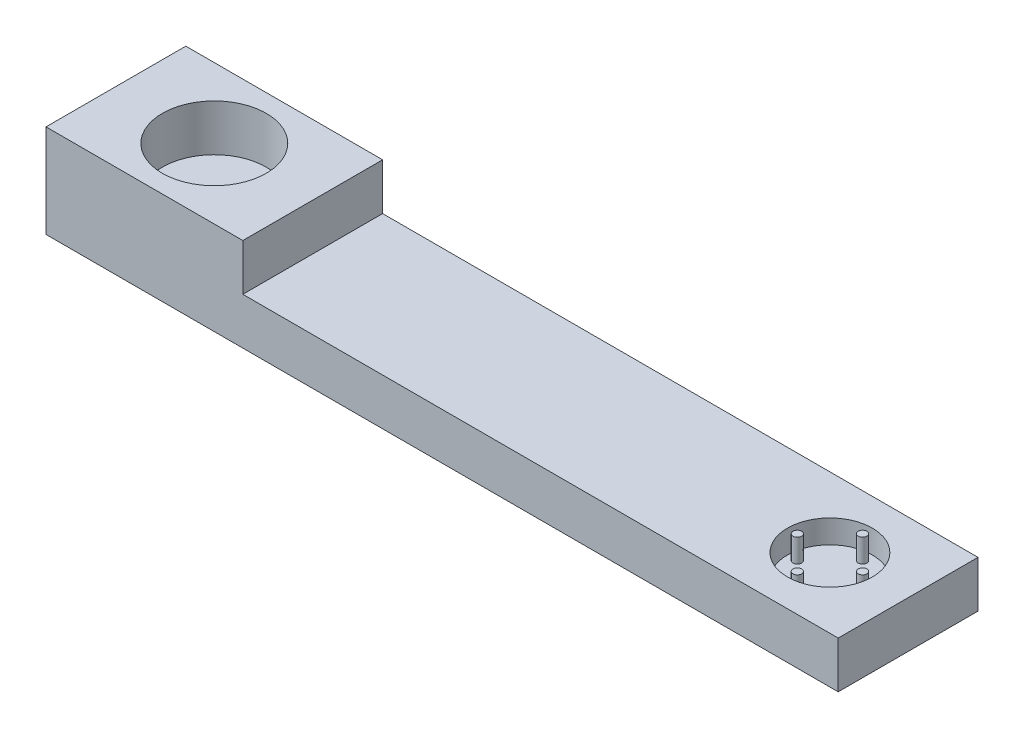
from build123d import *

# Parameters (mm, degrees)
SKETCH1_W           = 170
SKETCH1_H           = 30
BOSS_EXTRUDE1_DEPTH = 10
SKETCH2_W           = 42.237093354
SKETCH2_H           = 30
SKETCH2_R           = 11.15
BOSS_EXTRUDE3_DEPTH = 10
SKETCH4_R           = 9.1
CUT_EXTRUDE1_DEPTH  = 5
SKETCH5_R           = 0.925
BOSS_EXTRUDE4_DEPTH = 5


with BuildPart() as part:
    # Sketch1 → Boss-Extrude1 (new body)
    with BuildSketch(Plane(origin=(0, 0, 0), x_dir=(1, 0, 0), z_dir=(0, 1, 0))):
        Rectangle(SKETCH1_W, SKETCH1_H)
    extrude(amount=BOSS_EXTRUDE1_DEPTH)

    # Sketch2 → Boss-Extrude3 (add)
    with BuildSketch(Plane(origin=(0, 10, 0), x_dir=(1, 0, 0), z_dir=(0, 1, 0))):
        with Locations((-63.881453323, 0)):
            Rectangle(SKETCH2_W, SKETCH2_H)
        with Locations((-63.881453323, 0)):
            Circle(SKETCH2_R, mode=Mode.SUBTRACT)
    extrude(amount=BOSS_EXTRUDE3_DEPTH)

    # Sketch4 → Cut-Extrude1 (cut)
    with BuildSketch(Plane(origin=(0, 10, 0), x_dir=(1, 0, 0), z_dir=(0, 1, 0))):
        with Locations((68.221594526, 0)):
            Circle(SKETCH4_R)
    extrude(amount=-CUT_EXTRUDE1_DEPTH, mode=Mode.SUBTRACT)

    # Sketch5 → Boss-Extrude4 (add)
    with BuildSketch(Plane(origin=(0, 5, 0), x_dir=(1, 0, 0), z_dir=(0, 1, 0))):
        with Locations((68.221594526, 7)):
            Circle(SKETCH5_R)
        with Locations((68.221594526, -7)):
            Circle(SKETCH5_R)
        with Locations((61.221594526, 0)):
            Circle(SKETCH5_R)
        with Locations((75.221594526, 0)):
            Circle(SKETCH5_R)
    extrude(amount=BOSS_EXTRUDE4_DEPTH)


solid = part.part
